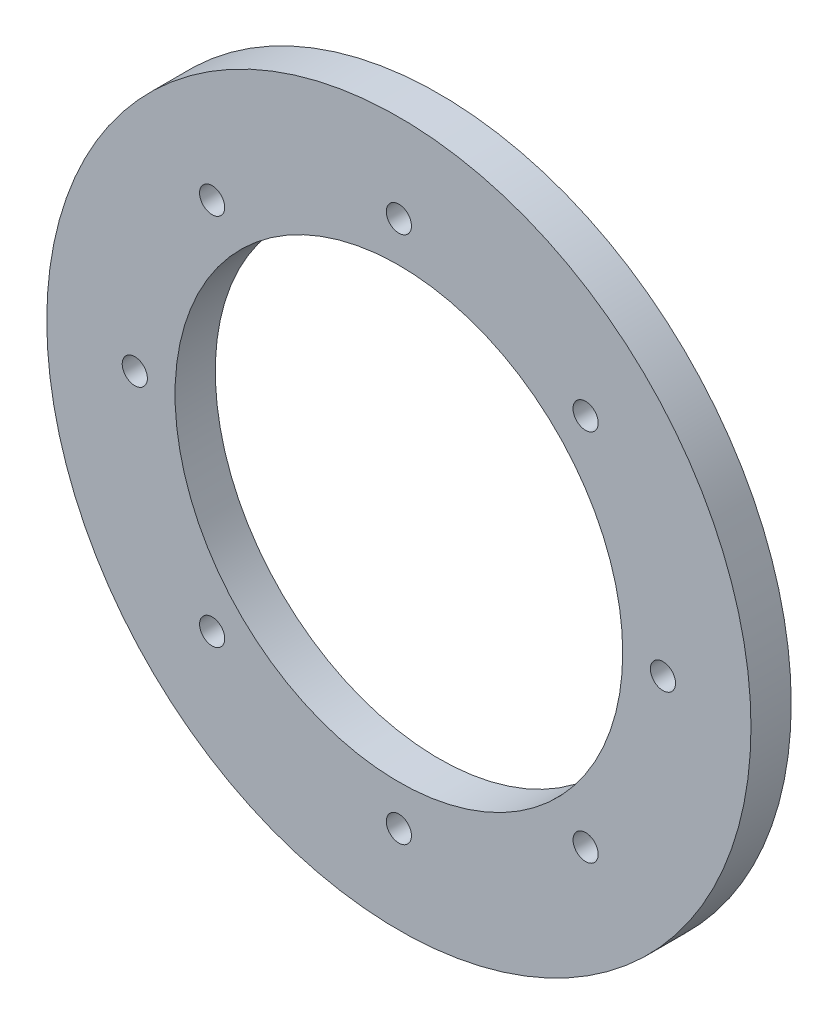
from build123d import *

# Parameters (mm, degrees)
SKETCH1_R           = 70
SKETCH1_R_2         = 44.5
SKETCH1_R_3         = 2.5
BOSS_EXTRUDE1_DEPTH = 8


with BuildPart() as part:
    # Sketch1 → Boss-Extrude1 (new body)
    with BuildSketch(Plane.XY):
        Circle(SKETCH1_R)
        Circle(SKETCH1_R_2, mode=Mode.SUBTRACT)
        with Locations((37.123106012, -37.123106012)):
            Circle(SKETCH1_R_3, mode=Mode.SUBTRACT)
        with Locations((52.5, 0)):
            Circle(SKETCH1_R_3, mode=Mode.SUBTRACT)
        with Locations((0, -52.5)):
            Circle(SKETCH1_R_3, mode=Mode.SUBTRACT)
        with Locations((-37.123106012, -37.123106012)):
            Circle(SKETCH1_R_3, mode=Mode.SUBTRACT)
        with Locations((-52.5, 0)):
            Circle(SKETCH1_R_3, mode=Mode.SUBTRACT)
        with Locations((37.123106012, 37.123106012)):
            Circle(SKETCH1_R_3, mode=Mode.SUBTRACT)
        with Locations((-37.123106012, 37.123106012)):
            Circle(SKETCH1_R_3, mode=Mode.SUBTRACT)
        with Locations((0, 52.5)):
            Circle(SKETCH1_R_3, mode=Mode.SUBTRACT)
    extrude(amount=BOSS_EXTRUDE1_DEPTH)


solid = part.part
